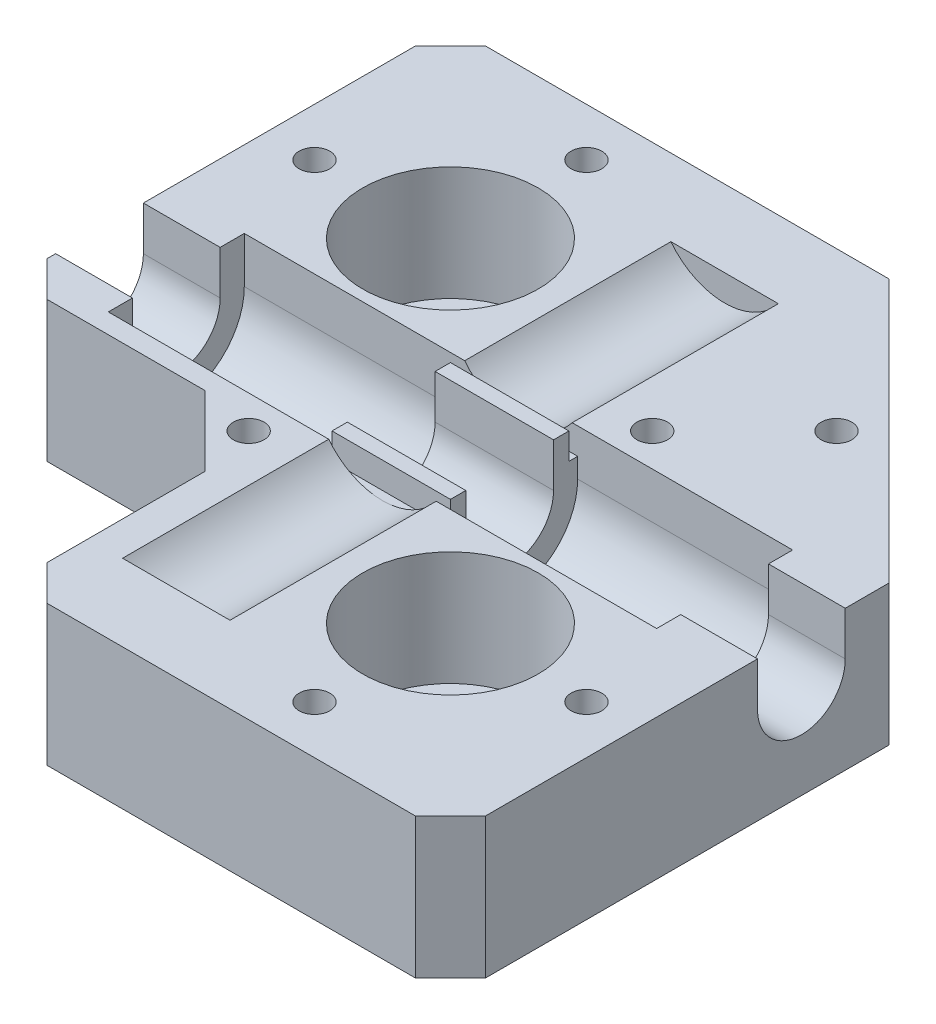
from build123d import *

# Parameters (mm, degrees)
SKETCH1_W               = 80
SKETCH1_H               = 80
BOSS_EXTRUDE1_DEPTH     = 16
CUT_EXTRUDE1_DEPTH      = 59.787753827
CUT_EXTRUDE1_DEPTH_BACK = 59.787753827
SKETCH2_R               = 1.75
SKETCH3_W               = 24.5
SKETCH3_H               = 15.5
CUT_EXTRUDE2_DEPTH      = 13
FILLET1_R               = 7.75
SKETCH4_W               = 15.5
SKETCH4_H               = 24.5
CUT_EXTRUDE3_DEPTH      = 3
BOSS_EXTRUDE2_DEPTH     = 23.5
CUT_EXTRUDE4_DEPTH      = 59.787753827
CUT_EXTRUDE4_DEPTH_BACK = 59.787753827
CUT_EXTRUDE5_DEPTH      = 59.787753827
CUT_EXTRUDE5_DEPTH_BACK = 59.787753827
SKETCH7_R               = 10
CUT_EXTRUDE6_DEPTH      = 59.787753827
CUT_EXTRUDE6_DEPTH_BACK = 59.787753827
CHAMFER1_SIZE           = 4
CHAMFER2_SIZE           = 30
BOSS_EXTRUDE4_START     = -3
SKETCH11_R              = 10
SKETCH11_R_2            = 4.25
BOSS_EXTRUDE4_DEPTH     = 3
SKETCH12_R              = 4
CUT_EXTRUDE7_DEPTH      = 5
CUT_EXTRUDE8_START      = -10
SKETCH13_R              = 3
SKETCH13_R_2            = 1.75
CUT_EXTRUDE8_DEPTH      = 10


with BuildPart() as part:
    # Sketch1 → Boss-Extrude1 (new body)
    with BuildSketch(Plane(origin=(0, 0, 0), x_dir=(1, 0, 0), z_dir=(0, 1, 0))):
        Rectangle(SKETCH1_W, SKETCH1_H)
    extrude(amount=-BOSS_EXTRUDE1_DEPTH)

    # Sketch2 → Cut-Extrude1 (cut, two sides: drawn at the far end of the back side and taken through both)
    with BuildSketch(Plane(origin=(0, 0, 0), x_dir=(1, 0, 0), z_dir=(0, 1, 0)).offset(-CUT_EXTRUDE1_DEPTH_BACK)):
        with Locations(Location((-11.5, -11.5, 0), (0, 0, 270))):
            Circle(SKETCH2_R)
        with Locations(Location((11.5, 11.5, 0), (0, 0, 270))):
            Circle(SKETCH2_R)
        with Locations(Location((22, 22, 0), (0, 0, 270))):
            Circle(SKETCH2_R)
        with Locations(Location((19, -34.5, 0), (0, 0, 270))):
            Circle(SKETCH2_R)
        with Locations(Location((34.5, -19, 0), (0, 0, 270))):
            Circle(SKETCH2_R)
        with Locations(Location((-34.5, 19, 0), (0, 0, 270))):
            Circle(SKETCH2_R)
        with Locations(Location((-19, 34.5, 0), (0, 0, 270))):
            Circle(SKETCH2_R)
    extrude(amount=CUT_EXTRUDE1_DEPTH + CUT_EXTRUDE1_DEPTH_BACK, mode=Mode.SUBTRACT)

    # Sketch3 → Cut-Extrude2 (cut)
    with BuildSketch(Plane(origin=(0, 0, 0), x_dir=(1, 0, 0), z_dir=(0, 1, 0))):
        with Locations((19, 0)):
            Rectangle(SKETCH3_W, SKETCH3_H)
        with Locations((-19, 0)):
            Rectangle(SKETCH3_W, SKETCH3_H)
    extrude(amount=-CUT_EXTRUDE2_DEPTH, mode=Mode.SUBTRACT)

    # Fillet1
    fillet1_edges = [part.edges().sort_by_distance(p)[0] for p in [
        (19, -13, 7.75),
        (19, -13, -7.75),
        (-19, -13, 7.75),
        (-19, -13, -7.75),
    ]]
    fillet(fillet1_edges, radius=FILLET1_R - 0.0001)  # a hair under: the kernel refuses the full size

    # Sketch4 → Cut-Extrude3 (cut)
    with BuildSketch(Plane(origin=(0, 0, 0), x_dir=(1, 0, 0), z_dir=(0, 1, 0))):
        with Locations((0, -19)):
            Rectangle(SKETCH4_W, SKETCH4_H)
        with Locations((0, 19)):
            Rectangle(SKETCH4_W, SKETCH4_H)
    extrude(amount=-CUT_EXTRUDE3_DEPTH, mode=Mode.SUBTRACT)

    # Sketch5 → Boss-Extrude2 (add)
    with BuildSketch(Plane(origin=(0, 0, 31.25), x_dir=(-1, 0, 0), z_dir=(0, 0, -1))):
        with BuildLine():
            ThreePointArc((-8e-09, -3), (-3.409545428, -2.209705452), (-6.123724357, 0))
            Line((-6.123724357, 0), (-7.75, 0))
            Line((-7.75, 0), (-7.75, -3))
            Line((-7.75, -3), (-8e-09, -3))
        make_face()
        with BuildLine():
            Line((7.75, -3), (7.75, 0))
            Line((7.75, 0), (6.123724357, 0))
            ThreePointArc((6.123724357, 0), (3.409545421, -2.209705455), (-8e-09, -3))
            Line((-8e-09, -3), (7.75, -3))
        make_face()
    boss_extrude2 = extrude(amount=BOSS_EXTRUDE2_DEPTH)

    # Mirror1: Boss-Extrude2 across plane
    add(boss_extrude2.mirror(Plane.XY))

    # Sketch6 → Cut-Extrude4 (cut, two sides: drawn at the far end of the back side and taken through both)
    with BuildSketch(Plane(origin=(0, 0, 0), x_dir=(0, 0, -1), z_dir=(1, 0, 0)).offset(-CUT_EXTRUDE4_DEPTH_BACK)):
        with BuildLine():
            ThreePointArc((-5, -5), (0, -10), (5, -5))
            Line((5, -5), (-5, -5))
        make_face()
        with BuildLine():
            Line((-5, -5), (5, -5))
            ThreePointArc((5, -5), (3.535533906, -1.464466094), (0, 0))
            ThreePointArc((0, 0), (-3.535533906, -1.464466094), (-5, -5))
        make_face()
        with BuildLine():
            Line((-5, 0), (-5, -5))
            ThreePointArc((-5, -5), (-3.535533906, -1.464466094), (0, 0))
            Line((0, 0), (-5, 0))
        make_face()
        with BuildLine():
            ThreePointArc((0, 0), (3.535533906, -1.464466094), (5, -5))
            Line((5, -5), (5, 0))
            Line((5, 0), (0, 0))
        make_face()
    extrude(amount=CUT_EXTRUDE4_DEPTH + CUT_EXTRUDE4_DEPTH_BACK, mode=Mode.SUBTRACT)

    # Sketch7 → Cut-Extrude5 (cut, two sides: drawn at the far end of the back side and taken through both)
    with BuildSketch(Plane(origin=(0, 0, 0), x_dir=(1, 0, 0), z_dir=(0, 1, 0)).offset(-CUT_EXTRUDE5_DEPTH_BACK)):
        with Locations(Location((19, -19, 0), (0, 0, 270))):
            Circle(SKETCH7_R)
        with Locations(Location((-19, 19, 0), (0, 0, 270))):
            Circle(SKETCH7_R)
    extrude(amount=CUT_EXTRUDE5_DEPTH + CUT_EXTRUDE5_DEPTH_BACK, mode=Mode.SUBTRACT)

    # Sketch9 → Cut-Extrude6 (cut, two sides: drawn at the far end of the back side and taken through both)
    with BuildSketch(Plane(origin=(0, 0, 0), x_dir=(1, 0, 0), z_dir=(0, 1, 0)).offset(-CUT_EXTRUDE6_DEPTH_BACK)):
        Polygon((-10, -18), (-18, -10), (-18, -18), align=None)
        Polygon((-10, -40), (-10, -18), (-18, -18), (-18, -10), (-40, -10), (-40, -40), align=None)
    extrude(amount=CUT_EXTRUDE6_DEPTH + CUT_EXTRUDE6_DEPTH_BACK, mode=Mode.SUBTRACT)

    # Chamfer1
    chamfer1_edges = [part.edges().sort_by_distance(p)[0] for p in [
        (-10, -8, 40),
        (-40, -8, 10),
        (40, -8, 40),
        (-40, -8, -40),
    ]]
    chamfer(chamfer1_edges, length=CHAMFER1_SIZE)

    # Chamfer2
    chamfer2_edges = [part.edges().sort_by_distance(p)[0] for p in [
        (40, -8, -40),
    ]]
    chamfer(chamfer2_edges, length=CHAMFER2_SIZE)

    # Sketch11 → Boss-Extrude4 (add)
    # profile 1 of 2: a face of its own
    with BuildSketch(Plane.XZ.offset(16).offset(BOSS_EXTRUDE4_START)):
        with Locations(Location((-19, -19, 0), (0, 0, 270))):
            Circle(SKETCH11_R)
        with Locations(Location((-19, -19, 0), (0, 0, 270))):
            Circle(SKETCH11_R_2, mode=Mode.SUBTRACT)
    # profile 2 of 2: a face of its own
    with BuildSketch(Plane.XZ.offset(16).offset(BOSS_EXTRUDE4_START)):
        with Locations(Location((19, 19, 0), (0, 0, 270))):
            Circle(SKETCH11_R)
        with Locations(Location((19, 19, 0), (0, 0, 270))):
            Circle(SKETCH11_R_2, mode=Mode.SUBTRACT)
    extrude(amount=BOSS_EXTRUDE4_DEPTH)

    # Sketch12 → Cut-Extrude7 (cut)
    with BuildSketch(Plane.XZ.offset(16)):
        with Locations(Location((0, 0, 0), (0, 0, 270))):
            Circle(SKETCH12_R)
        with Locations(Location((16.75, -16.75, 0), (0, 0, 270))):
            Circle(SKETCH12_R)
    extrude(amount=-CUT_EXTRUDE7_DEPTH, mode=Mode.SUBTRACT)

    # Sketch13 → Cut-Extrude8 (cut)
    # profile 1 of 7: a face of its own
    with BuildSketch(Plane.XZ.offset(16).offset(CUT_EXTRUDE8_START)):
        with Locations(Location((19, 34.5, 0), (0, 0, 270))):
            Circle(SKETCH13_R)
        with Locations(Location((19, 34.5, 0), (0, 0, 270))):
            Circle(SKETCH13_R_2, mode=Mode.SUBTRACT)
    # profile 2 of 7: a face of its own
    with BuildSketch(Plane.XZ.offset(16).offset(CUT_EXTRUDE8_START)):
        with Locations(Location((34.5, 19, 0), (0, 0, 270))):
            Circle(SKETCH13_R)
        with Locations(Location((34.5, 19, 0), (0, 0, 270))):
            Circle(SKETCH13_R_2, mode=Mode.SUBTRACT)
    # profile 3 of 7: a face of its own
    with BuildSketch(Plane.XZ.offset(16).offset(CUT_EXTRUDE8_START)):
        with Locations(Location((-11.5, 11.5, 0), (0, 0, 270))):
            Circle(SKETCH13_R)
        with Locations(Location((-11.5, 11.5, 0), (0, 0, 270))):
            Circle(SKETCH13_R_2, mode=Mode.SUBTRACT)
    # profile 4 of 7: a face of its own
    with BuildSketch(Plane.XZ.offset(16).offset(CUT_EXTRUDE8_START)):
        with Locations(Location((-34.5, -19, 0), (0, 0, 270))):
            Circle(SKETCH13_R)
        with Locations(Location((-34.5, -19, 0), (0, 0, 270))):
            Circle(SKETCH13_R_2, mode=Mode.SUBTRACT)
    # profile 5 of 7: a face of its own
    with BuildSketch(Plane.XZ.offset(16).offset(CUT_EXTRUDE8_START)):
        with Locations(Location((-19, -34.5, 0), (0, 0, 270))):
            Circle(SKETCH13_R)
        with Locations(Location((-19, -34.5, 0), (0, 0, 270))):
            Circle(SKETCH13_R_2, mode=Mode.SUBTRACT)
    # profile 6 of 7: a face of its own
    with BuildSketch(Plane.XZ.offset(16).offset(CUT_EXTRUDE8_START)):
        with Locations(Location((11.5, -11.5, 0), (0, 0, 270))):
            Circle(SKETCH13_R)
        with Locations(Location((11.5, -11.5, 0), (0, 0, 270))):
            Circle(SKETCH13_R_2, mode=Mode.SUBTRACT)
    # profile 7 of 7: a face of its own
    with BuildSketch(Plane.XZ.offset(16).offset(CUT_EXTRUDE8_START)):
        with Locations(Location((22, -22, 0), (0, 0, 270))):
            Circle(SKETCH13_R)
        with Locations(Location((22, -22, 0), (0, 0, 270))):
            Circle(SKETCH13_R_2, mode=Mode.SUBTRACT)
    extrude(amount=CUT_EXTRUDE8_DEPTH, mode=Mode.SUBTRACT)


solid = part.part
